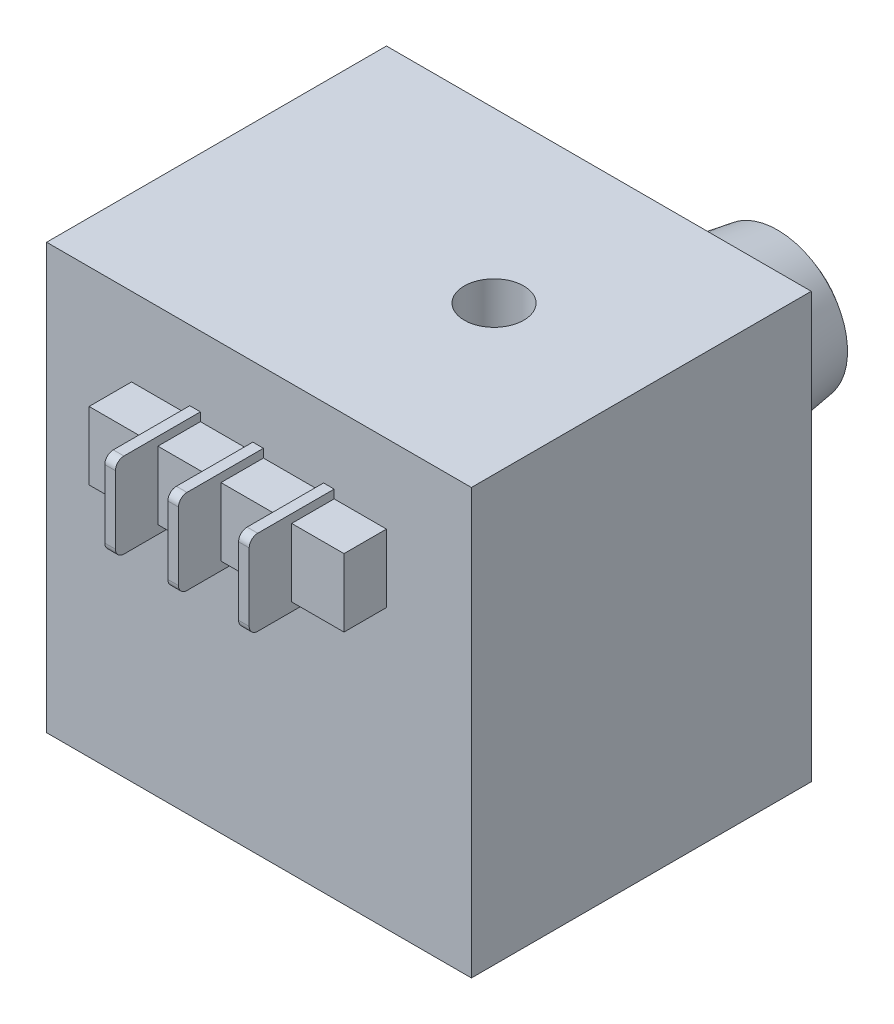
from build123d import *

# Parameters (mm, degrees)
SKETCH1_W                     = 63.5
SKETCH1_H                     = 63.5
BOSS_EXTRUDE1_DEPTH           = 50.8
SKETCH2_R                     = 2.54
BOSS_EXTRUDE2_DEPTH           = 12.7
SKETCH3_R                     = 12.7
BOSS_EXTRUDE3_DEPTH           = 15.24
BOSS_EXTRUDE3_TAPER           = 9
BOSS_EXTRUDE3_OTHER_WAY_DEPTH = 10.16
BOSS_EXTRUDE3_OTHER_WAY_TAPER = -9
BOSS_EXTRUDE4_START           = -25.4
SKETCH4_R                     = 18.536300075
BOSS_EXTRUDE4_DEPTH           = 3.175
BOSS_EXTRUDE4_TAPER           = 58
CHAMFER1_SIZE                 = 1.27
CHAMFER1_SIZE_2               = 1.527812426
SKETCH6_W                     = 38.1
SKETCH6_H                     = 10.16
BOSS_EXTRUDE6_DEPTH           = 6.35
BOSS_EXTRUDE7_DEPTH           = 6.35
BOSS_EXTRUDE7_DEPTH_BACK      = 6.35
SKETCH7_W                     = 1.5875
SKETCH7_H                     = 12.7
FILLET1_R                     = 1.27
SKETCH8_R                     = 4.445
CUT_EXTRUDE1_DEPTH            = 7.62


with BuildPart() as part:
    # Sketch1 → Boss-Extrude1 (new body)
    with BuildSketch(Plane.XY):
        Rectangle(SKETCH1_W, SKETCH1_H)
    extrude(amount=BOSS_EXTRUDE1_DEPTH)

    # Sketch2 → Boss-Extrude2 (add)
    with BuildSketch(Plane(origin=(0, 0, 0), x_dir=(-1, 0, 0), z_dir=(0, 0, -1))):
        with Locations(Location((0, 0, 0), (0, 0, 180))):
            Circle(SKETCH2_R)
    extrude(amount=BOSS_EXTRUDE2_DEPTH)

    # Sketch3 → Boss-Extrude3 (add)
    with BuildSketch(Plane(origin=(0, 0, -12.7), x_dir=(-1, 0, 0), z_dir=(0, 0, -1))):
        Circle(SKETCH3_R)
    extrude(amount=BOSS_EXTRUDE3_DEPTH, taper=BOSS_EXTRUDE3_TAPER)

    # Sketch3 → Boss-Extrude3 other way (add)
    with BuildSketch(Plane(origin=(0, 0, -12.7), x_dir=(-1, 0, 0), z_dir=(0, 0, -1))):
        Circle(SKETCH3_R)
    extrude(amount=-BOSS_EXTRUDE3_OTHER_WAY_DEPTH, taper=BOSS_EXTRUDE3_OTHER_WAY_TAPER)

    # Sketch4 → Boss-Extrude4 (add)
    with BuildSketch(Plane(origin=(0, 0, -27.94), x_dir=(-1, 0, 0), z_dir=(0, 0, -1)).offset(BOSS_EXTRUDE4_START)):
        Circle(SKETCH4_R)
    extrude(amount=BOSS_EXTRUDE4_DEPTH, taper=BOSS_EXTRUDE4_TAPER)

    # Chamfer1
    # the kernel refuses this chamfer: 1.527812426, 1.27 mm, written as the material it takes off along each edge
    with BuildSketch(Plane(origin=(0, 0, -27.94), x_dir=(-1, 0, 0), z_dir=(0, 1, 0))) as chamfer1_piece_1:
        Polygon((10.286221129 + CHAMFER1_SIZE * 0.15643446504, CHAMFER1_SIZE * 0.987688340595), (10.286221129 - CHAMFER1_SIZE_2, 0), (10.286221129, 0), align=None)
    revolve(axis=Axis((0, 0, -27.94), (0, 0, 1)), mode=Mode.SUBTRACT)

    # Sketch6 → Boss-Extrude6 (add)
    with BuildSketch(Plane.XY.offset(50.8)):
        with Locations((0, 14.933737581)):
            Rectangle(SKETCH6_W, SKETCH6_H)
    extrude(amount=BOSS_EXTRUDE6_DEPTH)

    # Sketch7 → Boss-Extrude7 (add, two sides: drawn at the far end of the back side and taken through both)
    with BuildSketch(Plane.XY.offset(57.15).offset(-BOSS_EXTRUDE7_DEPTH_BACK)):
        with Locations((-9.557292348, 14.933737581)):
            Rectangle(SKETCH7_W, SKETCH7_H)
        with Locations((-0.131236763, 14.933737581)):
            Rectangle(SKETCH7_W, SKETCH7_H)
        with Locations((10.440040529, 14.933737581)):
            Rectangle(SKETCH7_W, SKETCH7_H)
    extrude(amount=BOSS_EXTRUDE7_DEPTH + BOSS_EXTRUDE7_DEPTH_BACK)

    # Fillet1
    fillet1_edges = [part.edges().sort_by_distance(p)[0] for p in [
        (10.440040529, 21.283737581, 63.5),
        (10.440040529, 8.583737581, 63.5),
        (-0.131236763, 21.283737581, 63.5),
        (-0.131236763, 8.583737581, 63.5),
        (-9.557292348, 21.283737581, 63.5),
        (-9.557292348, 8.583737581, 63.5),
    ]]
    fillet(fillet1_edges, radius=FILLET1_R)

    # Sketch8 → Cut-Extrude1 (cut)
    with BuildSketch(Plane(origin=(0, 31.75, 0), x_dir=(1, 0, 0), z_dir=(0, 1, 0))):
        with Locations(Location((9.570348057, -25.239963614, 0), (0, 0, 270))):
            Circle(SKETCH8_R)
    extrude(amount=-CUT_EXTRUDE1_DEPTH, mode=Mode.SUBTRACT)


solid = part.part
